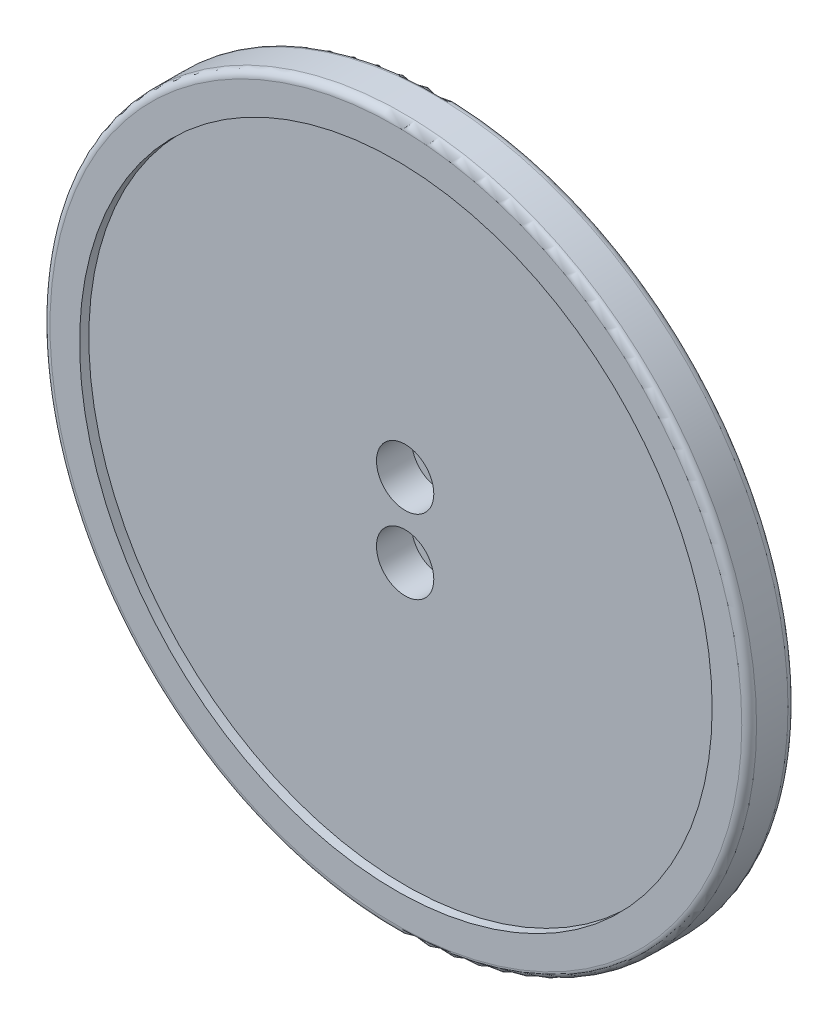
from build123d import *

# Parameters (mm, degrees)
SKETCH1_R           = 47.75
SKETCH1_R_2         = 42.75
BOSS_EXTRUDE1_DEPTH = 1.25
BOSS_EXTRUDE2_START = 5
SKETCH2_R           = 47.75
SKETCH2_R_2         = 2.25
BOSS_EXTRUDE2_DEPTH = 5
SKETCH3_R           = 3.875
CUT_EXTRUDE1_DEPTH  = 4.75
BOSS_EXTRUDE3_START = 10
SKETCH4_W           = 12.7
SKETCH4_H           = 20
SKETCH4_R           = 2.25
BOSS_EXTRUDE3_DEPTH = 10
FILLET1_R           = 10
FILLET2_R           = 1


with BuildPart() as part:
    # Sketch1 → Boss-Extrude1 (new body)
    with BuildSketch(Plane(origin=(0, 0, 0), x_dir=(0, 1, 0), z_dir=(0, 0, 1))):
        with Locations(Location((0, 0, 0), (0, 0, 270))):
            Circle(SKETCH1_R)
        with Locations(Location((0, 0, 0), (0, 0, 270))):
            Circle(SKETCH1_R_2, mode=Mode.SUBTRACT)
    extrude(amount=BOSS_EXTRUDE1_DEPTH)

    # Sketch2 → Boss-Extrude2 (add)
    with BuildSketch(Plane(origin=(0, 0, 0), x_dir=(1, 0, 0), z_dir=(0, 0, -1)).offset(BOSS_EXTRUDE2_START)):
        with Locations(Location((0, 0, 0), (0, 0, 180))):
            Circle(SKETCH2_R)
        with Locations(Location((0, 5, 0), (0, 0, 180))):
            Circle(SKETCH2_R_2, mode=Mode.SUBTRACT)
        with Locations(Location((0, -5, 0), (0, 0, 180))):
            Circle(SKETCH2_R_2, mode=Mode.SUBTRACT)
    extrude(amount=-BOSS_EXTRUDE2_DEPTH)

    # Sketch3 → Cut-Extrude1 (cut)
    with BuildSketch(Plane.XY):
        with Locations((0, 5)):
            Circle(SKETCH3_R)
        with Locations((0, -5)):
            Circle(SKETCH3_R)
    extrude(amount=-CUT_EXTRUDE1_DEPTH, mode=Mode.SUBTRACT)

    # Sketch4 → Boss-Extrude3 (add)
    with BuildSketch(Plane(origin=(0, 0, -5), x_dir=(1, 0, 0), z_dir=(0, 0, -1)).offset(BOSS_EXTRUDE3_START)):
        Rectangle(SKETCH4_W, SKETCH4_H)
        with Locations((0, 5)):
            Circle(SKETCH4_R, mode=Mode.SUBTRACT)
        with Locations((0, -5)):
            Circle(SKETCH4_R, mode=Mode.SUBTRACT)
    extrude(amount=-BOSS_EXTRUDE3_DEPTH)

    # Fillet1
    fillet1_edges = [part.edges().sort_by_distance(p)[0] for p in [
        (0, -10, -5),
        (-6.35, 0, -5),
        (0, 10, -5),
        (6.35, 0, -5),
    ]]
    fillet(fillet1_edges, radius=FILLET1_R - 0.0001)  # a hair under: the kernel refuses the full size

    # Fillet2
    fillet2_edges = [part.edges().sort_by_distance(p)[0] for p in [
        (47.75, 0, -5),
        (-47.75, 0, 1.25),
    ]]
    fillet(fillet2_edges, radius=FILLET2_R)


solid = part.part
